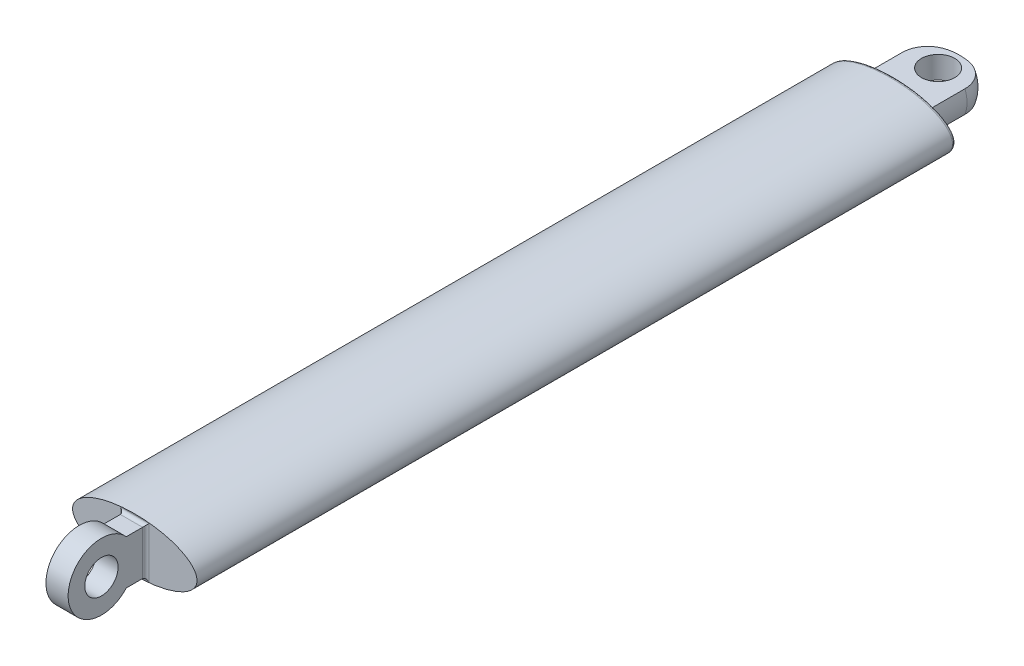
from build123d import *

# Parameters (mm, degrees)
BOSS_EXTRUDE1_DEPTH     = 469.7
SKETCH4_RX              = 28
SKETCH4_RY              = 12
BOSS_EXTRUDE3_DEPTH     = 10
SKETCH5_R               = 15
BOSS_EXTRUDE4_DEPTH     = 30
SKETCH6_W               = 28.284271248
SKETCH6_H               = 50
SKETCH6_H_2             = 11.161762602
CUT_EXTRUDE1_DEPTH      = 30
FILLET1_R               = 12
SKETCH7_R               = 7.5
CUT_EXTRUDE2_DEPTH      = 471.840833088
FILLET2_R               = 3
FILLET3_R               = 1.5
CUT_EXTRUDE3_DEPTH      = 200
CUT_EXTRUDE3_DEPTH_BACK = 200
SKETCH9_RX              = 28
SKETCH9_RY              = 12
BOSS_EXTRUDE5_DEPTH     = 5
BOSS_EXTRUDE6_START     = 35
SKETCH10_R              = 15
BOSS_EXTRUDE6_DEPTH     = 35
SKETCH11_W              = 49.356683536
SKETCH11_H              = 48.735951982
SKETCH11_W_2            = 10
SKETCH11_H_2            = 20
CUT_EXTRUDE4_DEPTH      = 35
SKETCH12_R              = 7.5
CUT_EXTRUDE5_DEPTH      = 379.27330016
SKETCH13_R              = 15
SKETCH13_R_2            = 7.5
BOSS_EXTRUDE7_DEPTH     = 10
CUT_EXTRUDE7_DEPTH      = 10
FILLET4_R               = 1.5


# Read off the part's stored shape, not the designer's step: Boss-Extrude1
with BuildPart() as part:
    # Boss-Extrude1 outline → Boss-Extrude1 (new body)
    with BuildSketch(Plane.XY):
        with BuildLine():
            add(Edge.make_bspline(
                [(28, 0), (28, 20.784609691), (-14, 10.392304845), (-56, 0), (-14, -10.392304845), (28, -20.784609691), (28, 0)],
                knots=[0, 0, 0, 2.094395102, 2.094395102, 4.188790205, 4.188790205, 6.283185307, 6.283185307, 6.283185307], degree=2, weights=[1, 0.5, 1, 0.5, 1, 0.5, 1]))
        make_face()
        with BuildLine():
            add(Edge.make_bspline(
                [(26.5, 0), (26.5, 0.55916982), (26.255643533, 1.677509459), (24.963605007, 3.547517059), (22.630258107, 5.430993798), (18.24756632, 7.728268117), (10.74227646, 9.889075395), (0, 10.805462303), (-10.74227646, 9.889075395), (-18.24756632, 7.728268117), (-22.630258107, 5.430993798), (-24.963605007, 3.547517059), (-26.255643533, 1.677509459), (-26.622178234, 0), (-26.255643533, -1.677509459), (-24.963605007, -3.547517059), (-22.630258107, -5.430993798), (-18.24756632, -7.728268117), (-10.74227646, -9.889075395), (0, -10.805462303), (10.74227646, -9.889075395), (18.24756632, -7.728268117), (22.630258107, -5.430993798), (24.963605007, -3.547517059), (26.255643533, -1.677509459), (26.5, -0.55916982), (26.5, 0)],
                knots=[0, 0, 0, 0, 0.196349541, 0.392699082, 0.589048623, 0.785398163, 1.178097245, 1.570796327, 1.963495408, 2.35619449, 2.552544031, 2.748893572, 2.945243113, 3.141592654, 3.337942194, 3.534291735, 3.730641276, 3.926990817, 4.319689899, 4.71238898, 5.105088062, 5.497787144, 5.694136685, 5.890486225, 6.086835766, 6.283185307, 6.283185307, 6.283185307, 6.283185307], degree=3))
        make_face(mode=Mode.SUBTRACT)
    extrude(amount=BOSS_EXTRUDE1_DEPTH)

    # Sketch4 → Boss-Extrude3 (add)
    with BuildSketch(Plane(origin=(0, 0, 0), x_dir=(-1, 0, 0), z_dir=(0, 0, -1))):
        with Locations((0, 0)):
            Ellipse(SKETCH4_RX, SKETCH4_RY)
    extrude(amount=-BOSS_EXTRUDE3_DEPTH)

    # Sketch5 → Boss-Extrude4 (add)
    with BuildSketch(Plane(origin=(0, 0, 0), x_dir=(-1, 0, 0), z_dir=(0, 0, -1))):
        with Locations(Location((0, 0, 0), (0, 0, 131.611654543))):
            Circle(SKETCH5_R)
    extrude(amount=BOSS_EXTRUDE4_DEPTH)

    # Sketch6 → Cut-Extrude1 (cut)
    with BuildSketch(Plane(origin=(0, 0, -30), x_dir=(-1, 0, 0), z_dir=(0, 0, -1))):
        with Locations((0, 30)):
            Rectangle(SKETCH6_W, SKETCH6_H)
        with Locations((0, -10.580881301)):
            Rectangle(SKETCH6_W, SKETCH6_H_2)
    extrude(amount=-CUT_EXTRUDE1_DEPTH, mode=Mode.SUBTRACT)

    # Fillet1
    # the kernel refuses this fillet: 12 mm, written as the material it takes off along each edge
    with BuildSketch(Plane(origin=(0, 0, -30), x_dir=(-0.6955541974737972, 0.7184736309542487, 0), z_dir=(-0.7184736309542487, -0.6955541974737972, 0))) as fillet1_piece_1:
        with BuildLine():
            CenterArc((15 - FILLET1_R, -FILLET1_R), FILLET1_R, 0, 90)
            Line((15, -FILLET1_R), (15, 0))
            Line((15, 0), (15 - FILLET1_R, 0))
        make_face()
    revolve(axis=Axis((0, 0, -30), (0, 0, -1)), revolution_arc=268.142792102, mode=Mode.SUBTRACT)
    with BuildSketch(Plane(origin=(0, 0, -30), x_dir=(0.695554197473797, -0.7184736309542489, 0), z_dir=(0.7184736309542489, 0.695554197473797, 0))) as fillet1_piece_2:
        with BuildLine():
            CenterArc((15 - FILLET1_R, -FILLET1_R), FILLET1_R, 0, 90)
            Line((15, -FILLET1_R), (15, 0))
            Line((15, 0), (15 - FILLET1_R, 0))
        make_face()
    revolve(axis=Axis((0, 0, -30), (0, 0, -1)), revolution_arc=268.142792102, mode=Mode.SUBTRACT)

    # Sketch7 → Cut-Extrude2 (cut, through all)
    with BuildSketch(Plane(origin=(0, 5, 0), x_dir=(1, 0, 0), z_dir=(0, 1, 0))):
        with Locations(Location((0.002135624, 20, 0), (0, 0, 270))):
            Circle(SKETCH7_R)
    extrude(amount=-CUT_EXTRUDE2_DEPTH, mode=Mode.SUBTRACT)

    # Fillet2
    fillet2_edges = [part.edges().sort_by_distance(p)[0] for p in [
        (15, 0, 0),
        (-15, 0, 0),
        (0, 5, 0),
        (0, -5, 0),
    ]]
    fillet(fillet2_edges, radius=FILLET2_R)

    # Fillet3
    fillet3_edges = [part.edges().sort_by_distance(p)[0] for p in [
        (0, 12, 0),
    ]]
    fillet(fillet3_edges, radius=FILLET3_R)

    # Sketch8 → Cut-Extrude3 (cut, two sides: drawn at the far end of the back side and taken through both)
    with BuildSketch(Plane(origin=(0, 0, 0), x_dir=(1, 0, 0), z_dir=(0, 1, 0)).offset(-CUT_EXTRUDE3_DEPTH_BACK)):
        Polygon((0.002135624, -341.64), (82.161889056, -341.64), (69.030287852, -470.509597335), (-45.089579759, -470.509597335), (-45.089579759, -341.64), align=None)
    extrude(amount=CUT_EXTRUDE3_DEPTH + CUT_EXTRUDE3_DEPTH_BACK, mode=Mode.SUBTRACT)

    # Sketch9 → Boss-Extrude5 (add)
    with BuildSketch(Plane.XY.offset(341.64)):
        with Locations((0, 0)):
            Ellipse(SKETCH9_RX, SKETCH9_RY)
    extrude(amount=-BOSS_EXTRUDE5_DEPTH)

    # Sketch10 → Boss-Extrude6 (add)
    with BuildSketch(Plane.XY.offset(341.64).offset(BOSS_EXTRUDE6_START)):
        with Locations(Location((0, 0, 0), (0, 0, 131.611654543))):
            Circle(SKETCH10_R)
    extrude(amount=-BOSS_EXTRUDE6_DEPTH)

    # Sketch11 → Cut-Extrude4 (cut)
    with BuildSketch(Plane.XY.offset(376.64)):
        Rectangle(SKETCH11_W, SKETCH11_H)
        Rectangle(SKETCH11_W_2, SKETCH11_H_2, mode=Mode.SUBTRACT)
    extrude(amount=-CUT_EXTRUDE4_DEPTH, mode=Mode.SUBTRACT)

    # Sketch12 → Cut-Extrude5 (cut, through all)
    with BuildSketch(Plane.ZY.offset(5)):
        with Locations(Location((361.64, 0, 0), (0, 0, 270))):
            Circle(SKETCH12_R)
    extrude(amount=-CUT_EXTRUDE5_DEPTH, mode=Mode.SUBTRACT)

    # Sketch13 → Boss-Extrude7 (add)
    with BuildSketch(Plane.ZY.offset(5)):
        with Locations((361.64, 0)):
            Circle(SKETCH13_R)
        with Locations(Location((361.64, 0, 0), (0, 0, 270))):
            Circle(SKETCH13_R_2, mode=Mode.SUBTRACT)
    extrude(amount=-BOSS_EXTRUDE7_DEPTH)

    # Sketch14 → Cut-Extrude7 (cut)
    with BuildSketch(Plane.ZY.offset(5)):
        with BuildLine():
            Line((361.64, 15), (361.64, 25.354833108))
            ThreePointArc((361.64, 25.354833108), (386.994833108, 0), (361.64, -25.354833108))
            Line((361.64, -25.354833108), (361.64, -15))
            ThreePointArc((361.64, -15), (376.64, 0), (361.64, 15))
        make_face()
    extrude(amount=-CUT_EXTRUDE7_DEPTH, mode=Mode.SUBTRACT)

    # Fillet4
    fillet4_edges = [part.edges().sort_by_distance(p)[0] for p in [
        (5, 0, 341.64),
        (0, 10, 341.64),
        (-5, 0, 341.64),
        (0, -10, 341.64),
    ]]
    fillet(fillet4_edges, radius=FILLET4_R)


solid = part.part
